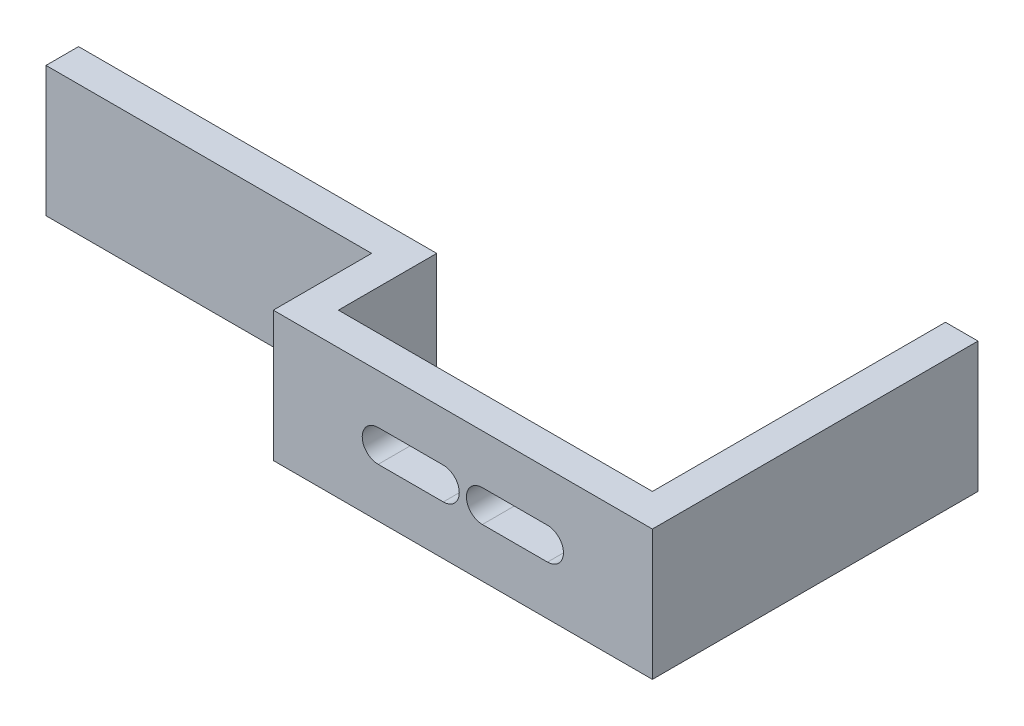
from build123d import *

# Parameters (mm, degrees)
BOSS_EXTRUDE1_DEPTH = 12.7
CUT_EXTRUDE1_DEPTH  = 51.359817495


with BuildPart() as part:
    # Sketch1 → Boss-Extrude1 (new body)
    with BuildSketch(Plane(origin=(0, 0, 0), x_dir=(1, 0, 0), z_dir=(0, 1, 0))):
        Polygon((0, 0), (36.9697, 0), (36.9697, 3.175), (36.9697, 31.75), (33.7947, 31.75), (33.7947, 3.175), (3.175, 3.175), (3.175, 12.7635), (0, 12.7635), (-31.75, 12.7635), (-31.75, 9.5885), (0, 9.5885), (0, 3.175), align=None)
    extrude(amount=BOSS_EXTRUDE1_DEPTH)

    # Sketch2 → Cut-Extrude1 (cut, through all)
    with BuildSketch(Plane.XY):
        with BuildLine():
            Line((10.22985, 7.90575), (16.57985, 7.90575))
            ThreePointArc((16.57985, 7.90575), (18.1356, 6.35), (16.57985, 4.79425))
            Line((16.57985, 4.79425), (10.22985, 4.79425))
            ThreePointArc((10.22985, 4.79425), (8.6741, 6.35), (10.22985, 7.90575))
        make_face()
        with BuildLine():
            Line((26.73985, 7.90575), (20.38985, 7.90575))
            ThreePointArc((20.38985, 7.90575), (18.8341, 6.35), (20.38985, 4.79425))
            Line((20.38985, 4.79425), (26.73985, 4.79425))
            ThreePointArc((26.73985, 4.79425), (28.2956, 6.35), (26.73985, 7.90575))
        make_face()
    extrude(amount=-CUT_EXTRUDE1_DEPTH, mode=Mode.SUBTRACT)


solid = part.part
